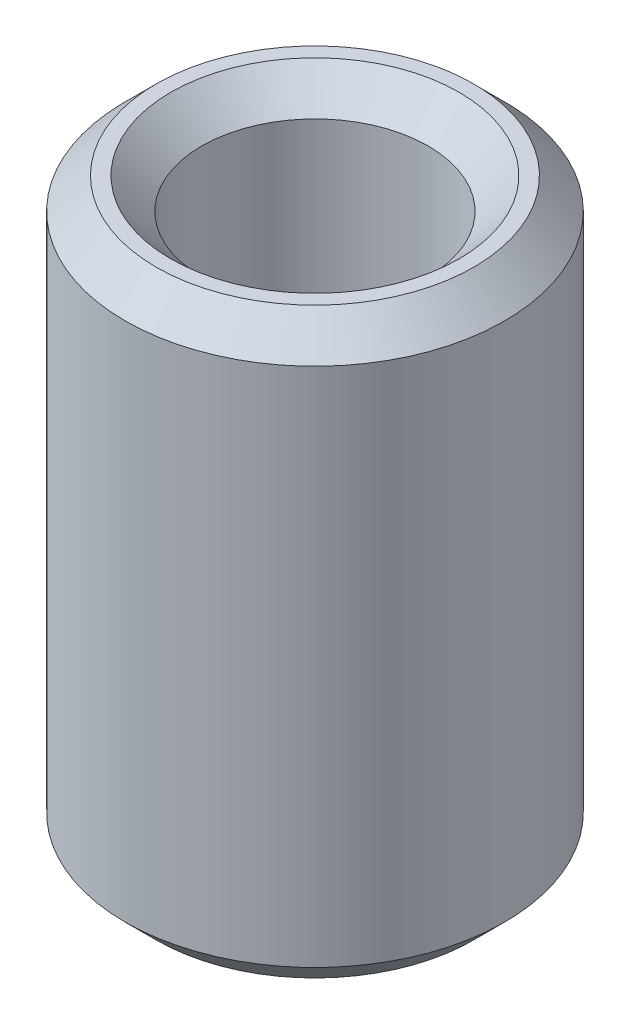
from build123d import *

# Parameters (mm, degrees)
SKETCH1_R           = 22.5
BOSS_EXTRUDE1_DEPTH = 69.091248927
SKETCH2_R           = 13.427660009
CUT_EXTRUDE1_DEPTH  = 77.066422804
CHAMFER1_SIZE       = 3.674796484


with BuildPart() as part:
    # Sketch1 → Boss-Extrude1 (new body)
    with BuildSketch(Plane(origin=(0, 0, 0), x_dir=(1, 0, 0), z_dir=(0, 1, 0))):
        Circle(SKETCH1_R)
    extrude(amount=BOSS_EXTRUDE1_DEPTH)

    # Sketch2 → Cut-Extrude1 (cut, through all)
    with BuildSketch(Plane(origin=(0, 0, 0), x_dir=(1, 0, 0), z_dir=(0, 1, 0))):
        Circle(SKETCH2_R)
    extrude(amount=CUT_EXTRUDE1_DEPTH, mode=Mode.SUBTRACT)

    # Chamfer1
    chamfer1_edges = [part.edges().sort_by_distance(p)[0] for p in [
        (-13.427660009, 69.091248927, 0),
        (-13.427660009, 0, 0),
        (-22.5, 0, 0),
        (-22.5, 69.091248927, 0),
    ]]
    chamfer(chamfer1_edges, length=CHAMFER1_SIZE)


solid = part.part
